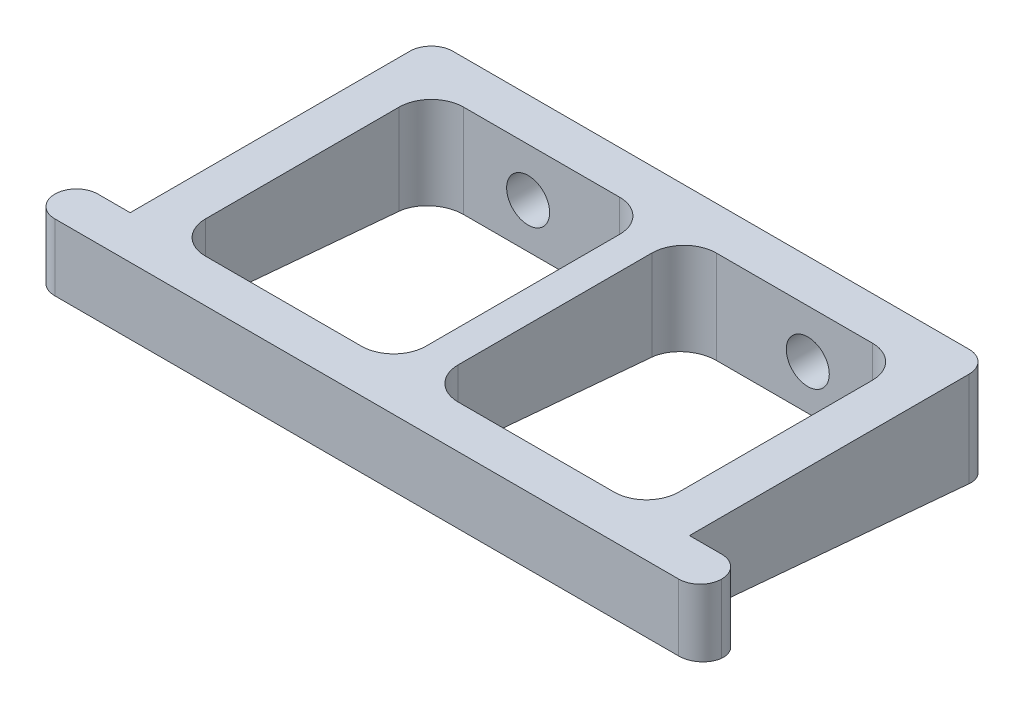
from build123d import *

# Parameters (mm, degrees)
SKETCH1_W           = 20.5
SKETCH1_H           = 24
BOSS_EXTRUDE1_DEPTH = 9
FILLET1_R           = 3
FILLET2_R           = 2
CUT_EXTRUDE1_REACH  = 47.453
SKETCH2_R           = 2
DRAFT1_START        = -1.394491884
DRAFT1_OUTLINE_W    = 64
DRAFT1_OUTLINE_H    = 35
DRAFT1_DEPTH        = 2.788983768


# Read off the part's stored shape, not the designer's step: Draft1
with BuildPart() as part:
    # Sketch1 → Boss-Extrude1 (new body)
    with BuildSketch(Plane(origin=(0, 0, 0), x_dir=(1, 0, 0), z_dir=(0, 1, 0))):
        Polygon((-26, 16), (26, 16), (26, -12), (31, -12), (31, -16), (26, -16), (-26, -16), (-31, -16), (-31, -12), (-26, -12), align=None)
        with Locations((-11.75, 0)):
            Rectangle(SKETCH1_W, SKETCH1_H, mode=Mode.SUBTRACT)
        with Locations((11.75, 0)):
            Rectangle(SKETCH1_W, SKETCH1_H, mode=Mode.SUBTRACT)
    extrude(amount=BOSS_EXTRUDE1_DEPTH)

    # Fillet1
    fillet1_edges = [part.edges().sort_by_distance(p)[0] for p in [
        (-1.5, 4.5, 12),
        (-1.5, 4.5, -12),
        (-22, 4.5, -12),
        (-22, 4.5, 12),
        (22, 4.5, 12),
        (22, 4.5, -12),
        (1.5, 4.5, -12),
        (1.5, 4.5, 12),
    ]]
    fillet(fillet1_edges, radius=FILLET1_R)

    # Fillet2
    fillet2_edges = [part.edges().sort_by_distance(p)[0] for p in [
        (-26, 4.5, -16),
        (26, 4.5, -16),
        (31, 4.5, 16),
        (31, 4.5, 12),
        (-31, 4.5, 12),
        (-31, 4.5, 16),
    ]]
    fillet(fillet2_edges, radius=FILLET2_R - 0.0001)  # a hair under: the kernel refuses the full size

    # Sketch2 → Cut-Extrude1 (cut, up to next)
    with BuildSketch(Plane(origin=(0, 0, -16), x_dir=(-1, 0, 0), z_dir=(0, 0, -1)), mode=Mode.PRIVATE) as cut_extrude1_sk1:
        with Locations((-13, 4.5)):
            Circle(SKETCH2_R)
    cut_extrude1_tool1 = extrude(cut_extrude1_sk1.sketch, amount=-CUT_EXTRUDE1_REACH, mode=Mode.PRIVATE) & part.part
    # Sketch2 → Cut-Extrude1 (cut, up to next)
    with BuildSketch(Plane(origin=(0, 0, -16), x_dir=(-1, 0, 0), z_dir=(0, 0, -1)), mode=Mode.PRIVATE) as cut_extrude1_sk2:
        with Locations(Location((13, 4.5, 0), (0, 0, 180))):
            Circle(SKETCH2_R)
    cut_extrude1_tool2 = extrude(cut_extrude1_sk2.sketch, amount=-CUT_EXTRUDE1_REACH, mode=Mode.PRIVATE) & part.part
    add(cut_extrude1_tool1.solids().sort_by_distance((13, 4.5, -16))[0], mode=Mode.SUBTRACT)
    add(cut_extrude1_tool2.solids().sort_by_distance((-13, 4.5, -16))[0], mode=Mode.SUBTRACT)

    # Draft1 outline → Draft1 (cut)
    with BuildSketch(Plane(origin=(0, 0, 0), x_dir=(1, 0, 0), z_dir=(0, 0.9961946980917455, -0.08715574274765824)).offset(DRAFT1_START)):
        with Locations((0, -0.5)):
            Rectangle(DRAFT1_OUTLINE_W, DRAFT1_OUTLINE_H)
    extrude(amount=DRAFT1_DEPTH, mode=Mode.SUBTRACT)


solid = part.part
